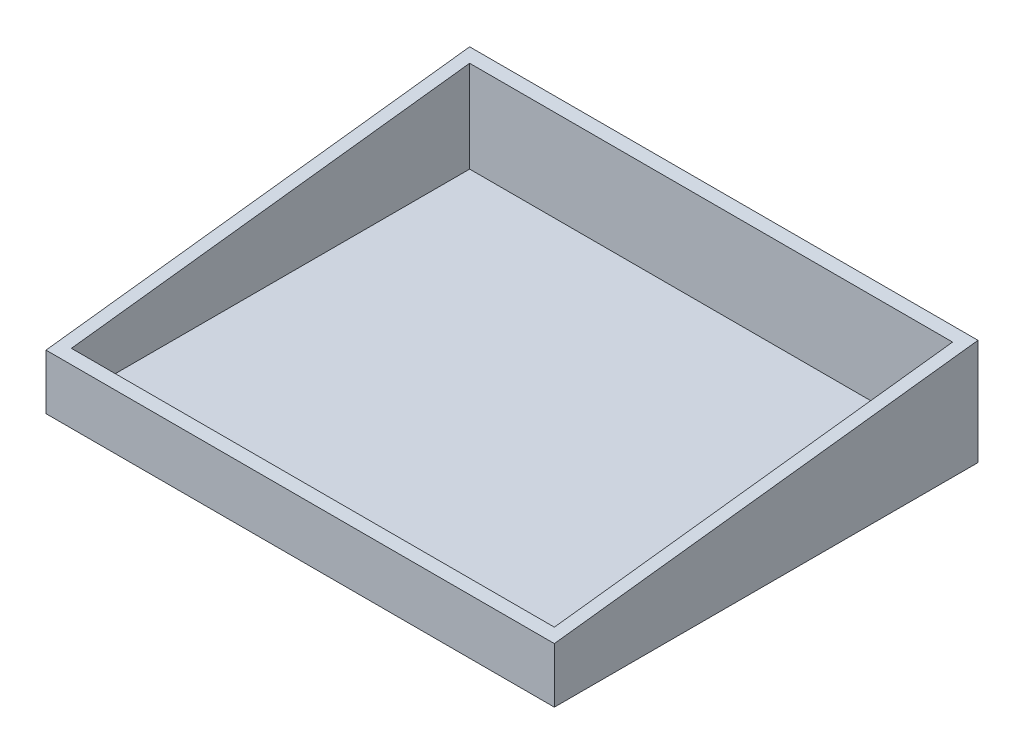
from build123d import *

# Parameters (mm, degrees)
SKETCH1_W               = 120
SKETCH1_H               = 100
BOSS_EXTRUDE1_DEPTH     = 25
CUT_EXTRUDE1_DEPTH      = 159.192920196
CUT_EXTRUDE1_DEPTH_BACK = 159.192920196
SHELL1_T                = -3


with BuildPart() as part:
    # Sketch1 → Boss-Extrude1 (new body)
    with BuildSketch(Plane(origin=(0, 0, 0), x_dir=(1, 0, 0), z_dir=(0, 1, 0))):
        with Locations((60, 50)):
            Rectangle(SKETCH1_W, SKETCH1_H)
    extrude(amount=BOSS_EXTRUDE1_DEPTH)

    # Sketch2 → Cut-Extrude1 (cut, two sides: drawn at the far end of the back side and taken through both)
    with BuildSketch(Plane(origin=(120, 0, 0), x_dir=(0, 0, -1), z_dir=(1, 0, 0)).offset(-CUT_EXTRUDE1_DEPTH_BACK)):
        Polygon((0, 13), (0, 25), (100, 25), align=None)
    extrude(amount=CUT_EXTRUDE1_DEPTH + CUT_EXTRUDE1_DEPTH_BACK, mode=Mode.SUBTRACT)

    # Shell1
    shell1_openings = [part.faces().sort_by_distance(p)[0] for p in [
        (60, 19, -50),
    ]]
    offset(amount=SHELL1_T, openings=shell1_openings, kind=Kind.INTERSECTION)


solid = part.part
